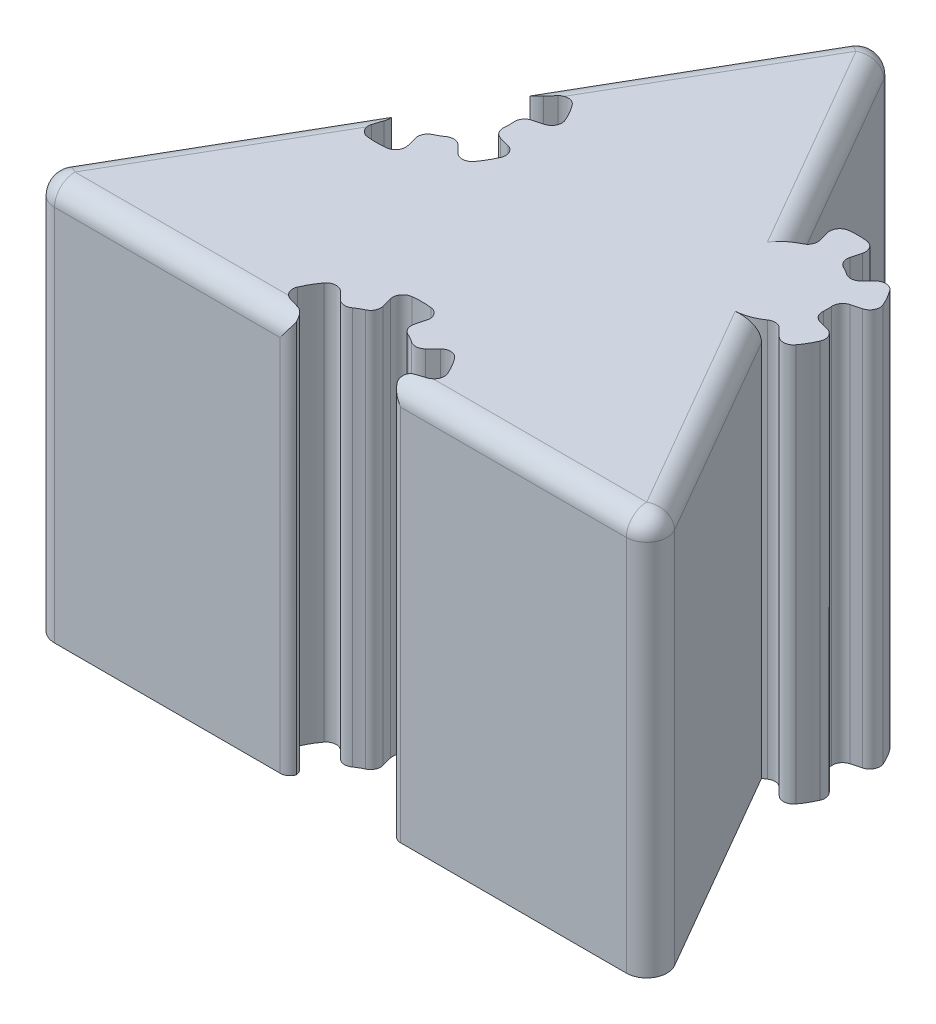
from build123d import *

# Parameters (mm, degrees)
BOSS_EXTRUDE1_DEPTH = 19.5
CUT_EXTRUDE1_DEPTH  = 30.603631534
BOSS_EXTRUDE2_DEPTH = 19.5
FILLET2_R           = 0.5
FILLET4_R           = 1
CUT_EXTRUDE6_DEPTH  = 17


with BuildPart() as part:
    # Sketch1 → Boss-Extrude1 (new body)
    with BuildSketch(Plane(origin=(0, 0, 0), x_dir=(1, 0, 0), z_dir=(0, 1, 0))):
        Polygon((0, 15.75), (-15.75, -11.529800219), (15.75, -11.529800219), align=None)
    extrude(amount=BOSS_EXTRUDE1_DEPTH)

    # Sketch2 → Cut-Extrude1 (cut, through all)
    with BuildSketch(Plane(origin=(0, 19.5, 0), x_dir=(1, 0, 0), z_dir=(0, 1, 0))):
        with BuildLine():
            Line((-6.625, 4.2751634), (-9.125, -0.054963619))
            ThreePointArc((-9.125, -0.054963619), (-8.831708581, -0.199598941), (-8.522047613, -0.304714675))
            Line((-8.522047613, -0.304714675), (-8.91027618, -1.753603415))
            ThreePointArc((-8.91027618, -1.753603415), (-7.875, -1.88990011), (-6.83972382, -1.753603415))
            Line((-6.83972382, -1.753603415), (-7.227952387, -0.304714675))
            ThreePointArc((-7.227952387, -0.304714675), (-6.625, -0.054963619), (-6.107233047, 0.342332937))
            Line((-6.107233047, 0.342332937), (-5.046572875, -0.718327234))
            ThreePointArc((-5.046572875, -0.718327234), (-4.410898385, 0.11009989), (-4.011296695, 1.07482371))
            Line((-4.011296695, 1.07482371), (-5.460185434, 1.463052278))
            ThreePointArc((-5.460185434, 1.463052278), (-5.375, 2.11009989), (-5.460185434, 2.757147503))
            Line((-5.460185434, 2.757147503), (-4.011296695, 3.145376071))
            ThreePointArc((-4.011296695, 3.145376071), (-4.410898385, 4.11009989), (-5.046572875, 4.938527015))
            Line((-5.046572875, 4.938527015), (-6.107233047, 3.877866843))
            ThreePointArc((-6.107233047, 3.877866843), (-6.353096427, 4.093483241), (-6.625, 4.2751634))
        make_face()
        with BuildLine():
            Line((-2.5, -11.529800219), (2.5, -11.529800219))
            ThreePointArc((2.5, -11.529800219), (2.478612153, -11.203484739), (2.414814566, -10.882752606))
            Line((2.414814566, -10.882752606), (3.863703305, -10.494524039))
            ThreePointArc((3.863703305, -10.494524039), (3.464101615, -9.529800219), (2.828427125, -8.701373094))
            Line((2.828427125, -8.701373094), (1.767766953, -9.762033266))
            ThreePointArc((1.767766953, -9.762033266), (1.25, -9.36473671), (0.647047613, -9.114985653))
            Line((0.647047613, -9.114985653), (1.03527618, -7.666096914))
            ThreePointArc((1.03527618, -7.666096914), (0, -7.529800219), (-1.03527618, -7.666096914))
            Line((-1.03527618, -7.666096914), (-0.647047613, -9.114985653))
            ThreePointArc((-0.647047613, -9.114985653), (-1.25, -9.36473671), (-1.767766953, -9.762033266))
            Line((-1.767766953, -9.762033266), (-2.828427125, -8.701373094))
            ThreePointArc((-2.828427125, -8.701373094), (-3.464101615, -9.529800219), (-3.863703305, -10.494524039))
            Line((-3.863703305, -10.494524039), (-2.414814566, -10.882752606))
            ThreePointArc((-2.414814566, -10.882752606), (-2.478612153, -11.203484739), (-2.5, -11.529800219))
        make_face()
    extrude(amount=-CUT_EXTRUDE1_DEPTH, mode=Mode.SUBTRACT)

    # Sketch2<3> → Boss-Extrude2 (add, through all)
    with BuildSketch(Plane(origin=(0, 19.5, 0), x_dir=(1, 0, 0), z_dir=(0, 1, 0))):
        with BuildLine():
            ThreePointArc((7.260304768, 4.404173728), (6.966126848, 4.30431378), (6.6875, 4.166910224))
            Line((6.6875, 4.166910224), (9.0625, 0.053289556))
            ThreePointArc((9.0625, 0.053289556), (9.320808394, 0.225885707), (9.554378605, 0.430721285))
            Line((9.554378605, 0.430721285), (10.615038777, -0.629938887))
            ThreePointArc((10.615038777, -0.629938887), (11.23084844, 0.17259989), (11.617962577, 1.107176091))
            Line((11.617962577, 1.107176091), (10.169073837, 1.495404658))
            ThreePointArc((10.169073837, 1.495404658), (10.25, 2.11009989), (10.169073837, 2.724795123))
            Line((10.169073837, 2.724795123), (11.617962577, 3.11302369))
            ThreePointArc((11.617962577, 3.11302369), (11.23084844, 4.04759989), (10.615038777, 4.850138667))
            Line((10.615038777, 4.850138667), (9.554378605, 3.789478496))
            ThreePointArc((9.554378605, 3.789478496), (9.0625, 4.166910224), (8.489695232, 4.404173728))
            Line((8.489695232, 4.404173728), (8.8779238, 5.853062467))
            ThreePointArc((8.8779238, 5.853062467), (7.875, 5.98509989), (6.8720762, 5.853062467))
            Line((6.8720762, 5.853062467), (7.260304768, 4.404173728))
        make_face()
    extrude(amount=-BOSS_EXTRUDE2_DEPTH)

    # Fillet2
    # the kernel refuses this fillet: 0.5 mm, written as the material it adds along each edge
    with BuildSketch(Plane(origin=(10.169073837, 19.5, -1.495404658), x_dir=(0.9659258262890719, 0, 0.25881904510250725), z_dir=(0, -1, 0)), Plane(origin=(9.554378605, 19.5, -3.789478496), x_dir=(0.7071067811865348, 0, -0.7071067811865601), z_dir=(0, -1, 0))) as fillet2_piece_1:
        with BuildLine():
            CenterArc((0.456187913, -0.5), FILLET2_R, 90, 79.984589832)
            ThreePointArc((-0.036192593, -0.413043478), (-0.00906545, -0.20731306), (0, 0))
            Line((0, 0), (0.456187913, 0))
        make_face()
    extrude(amount=19.5)
    with BuildSketch(Plane(origin=(9.554378605, 19.5, -0.430721285), x_dir=(-0.7661308776828692, 0, 0.6426845869171569), z_dir=(0, -1, 0)), Plane(origin=(8.489695232, 19.5, -4.404173728), x_dir=(0.9396466177324048, 0, 0.3421465092384431), z_dir=(0, -1, 0)), Plane(origin=(10.169073837, 19.5, -2.724795123), x_dir=(0.1735157400495422, 0, 0.9848310961556098), z_dir=(0, -1, 0))) as fillet2_piece_2:
        with BuildLine():
            CenterArc((0.458270974, -0.498091484), FILLET2_R, 95.007705084, 79.984589832)
            Line((-0.03982051, -0.45444663), (0, 0))
            ThreePointArc((0, 0), (0.20731306, -0.00906545), (0.414626119, 0))
        make_face()
    extrude(amount=19.5)
    with BuildSketch(Plane(origin=(7.260304768, 19.5, -4.404173728), x_dir=(-0.939646617732391, 0, 0.3421465092384808), z_dir=(0, -1, 0))) as fillet2_piece_3:
        with BuildLine():
            CenterArc((0.458270974, 0.498091484), FILLET2_R, 185.007705084, 79.984589832)
            Line((-0.03982051, 0.45444663), (0, 0))
            ThreePointArc((0, 0), (0.20731306, 0.00906545), (0.414626119, 0))
        make_face()
    extrude(amount=19.5)
    with BuildSketch(Plane(origin=(-5.046572875, 19.5, -4.938527015), x_dir=(0.6546536707079752, 0, 0.7559289460184561), z_dir=(0, -1, 0)), Plane(origin=(-4.011296695, 19.5, -1.07482371), x_dir=(-0.32732683535399293, 0, 0.9449111825230665), z_dir=(0, -1, 0)), Plane(origin=(-6.83972382, 19.5, 1.753603415), x_dir=(-0.9819805060619667, 0, 0.18898223650460844), z_dir=(0, -1, 0)), Plane(origin=(2.828427125, 19.5, 8.701373094), x_dir=(0.6546536707079803, 0, 0.7559289460184518), z_dir=(0, -1, 0)), Plane(origin=(-3.863703305, 19.5, 10.494524039), x_dir=(0.3273268353539898, 0, -0.9449111825230676), z_dir=(0, -1, 0)), Plane(origin=(-1.03527618, 19.5, 7.666096914), x_dir=(0.9819805060619656, 0, -0.18898223650461404), z_dir=(0, -1, 0))) as fillet2_piece_4:
        with BuildLine():
            CenterArc((0.537093255, 0.498716267), FILLET2_R, 175.893394649, 98.213210702)
            Line((0.038376988, 0.534522484), (0, 0))
            ThreePointArc((0, 0), (0.286449736, -0.010269865), (0.572899472, 0))
        make_face()
    extrude(amount=19.5)
    with BuildSketch(Plane(origin=(-4.011296695, 19.5, -3.145376071), x_dir=(-0.9659258262890685, 0, 0.25881904510251963), z_dir=(0, -1, 0)), Plane(origin=(-5.046572875, 19.5, 0.718327234), x_dir=(-0.7071067811865451, 0, -0.7071067811865498), z_dir=(0, -1, 0)), Plane(origin=(-8.91027618, 19.5, 1.753603415), x_dir=(0.25881904510252574, 0, -0.965925826289067), z_dir=(0, -1, 0)), Plane(origin=(3.863703305, 19.5, 10.494524039), x_dir=(-0.9659258262890678, 0, 0.2588190451025225), z_dir=(0, -1, 0)), Plane(origin=(-2.828427125, 19.5, 8.701373094), x_dir=(0.7071067811865509, 0, 0.7071067811865442), z_dir=(0, -1, 0)), Plane(origin=(1.03527618, 19.5, 7.666096914), x_dir=(-0.2588190451025172, 0, 0.9659258262890692), z_dir=(0, -1, 0))) as fillet2_piece_5:
        with BuildLine():
            CenterArc((0.535898385, 0.5), FILLET2_R, 171.786789298, 98.213210702)
            ThreePointArc((0.041026726, 0.571428571), (0.010269865, 0.286449736), (0, 0))
            Line((0, 0), (0.535898385, 0))
        make_face()
    extrude(amount=19.5)
    # the kernel refuses this fillet: 0.5 mm, written as the material it takes off along each edge
    with BuildSketch(Plane(origin=(11.617962577, 20.939160897, -1.107176091), x_dir=(-0.32985231937678383, 0, 0.944032545732273), z_dir=(0, -1, 0)), Plane(origin=(6.8720762, 20.939160897, -5.853062467), x_dir=(0.9824823262918342, 0, -0.1863557847886294), z_dir=(0, -1, 0)), Plane(origin=(10.615038777, 20.939160897, -4.850138667), x_dir=(0.6526300069150524, 0, 0.7576767609436486), z_dir=(0, -1, 0))) as fillet2_2_piece_1:
        with BuildLine():
            CenterArc((0.538524723, 0.49861874), FILLET2_R, 175.740187873, 98.519624254)
            Line((0.039905983, 0.535758376), (0, 0))
            ThreePointArc((0, 0), (0.287832179, -0.010704768), (0.575664359, 0))
        make_face()
    extrude(amount=22.378321794, mode=Mode.SUBTRACT)
    with BuildSketch(Plane(origin=(10.615038777, 20.939160897, 0.629938887), x_dir=(-0.7071067811865556, 0, -0.7071067811865395), z_dir=(0, -1, 0)), Plane(origin=(8.8779238, 20.939160897, -5.853062467), x_dir=(-0.2588190451025015, 0, 0.9659258262890735), z_dir=(0, -1, 0)), Plane(origin=(11.617962577, 20.939160897, -3.11302369), x_dir=(-0.9659258262890641, 0, 0.25881904510253667), z_dir=(0, -1, 0))) as fillet2_2_piece_2:
        with BuildLine():
            CenterArc((0.537242519, 0.5), FILLET2_R, 171.480375746, 98.519624254)
            ThreePointArc((0.04275993, 0.574074074), (0.010704768, 0.287832179), (0, 0))
            Line((0, 0), (0.537242519, 0))
        make_face()
    extrude(amount=22.378321794, mode=Mode.SUBTRACT)
    with BuildSketch(Plane(origin=(-6.107233047, 20.645099729, -3.877866843), x_dir=(-0.7637626158259737, 0, -0.6454972243679022), z_dir=(0, -1, 0)), Plane(origin=(-5.460185434, 20.645099729, -1.463052278), x_dir=(0.17713568646196357, 0, -0.9841864399500986), z_dir=(0, -1, 0)), Plane(origin=(-7.227952387, 20.645099729, 0.304714675), x_dir=(0.9408983022879361, 0, -0.33868921558219084), z_dir=(0, -1, 0)), Plane(origin=(-9.125, 20.645099729, 0.054963619), x_dir=(0.9048050110076324, 0, 0.4258261289017831), z_dir=(0, -1, 0)), Plane(origin=(1.767766953, 20.645099729, 9.762033266), x_dir=(-0.7637626158259726, 0, -0.6454972243679037), z_dir=(0, -1, 0)), Plane(origin=(2.5, 20.645099729, 11.529800219), x_dir=(-0.08362626027968346, 0, -0.9964971894549601), z_dir=(0, -1, 0)), Plane(origin=(-2.414814566, 20.645099729, 10.882752606), x_dir=(-0.17713568646195918, 0, 0.9841864399500994), z_dir=(0, -1, 0)), Plane(origin=(-0.647047613, 20.645099729, 9.114985653), x_dir=(-0.9408983022879326, 0, 0.3386892155822002), z_dir=(0, -1, 0))) as fillet2_2_piece_3:
        with BuildLine():
            CenterArc((0.459944432, 0.498248595), FILLET2_R, 184.797034113, 80.405931773)
            Line((-0.038304163, 0.456435465), (0, 0))
            ThreePointArc((0, 0), (0.209065651, 0.008757026), (0.418131301, 0))
        make_face()
    extrude(amount=21.790199458, mode=Mode.SUBTRACT)
    with BuildSketch(Plane(origin=(-5.460185434, 20.645099729, -2.757147503), x_dir=(0.9659258262890686, 0, -0.2588190451025195), z_dir=(0, -1, 0)), Plane(origin=(-6.107233047, 20.645099729, -0.342332937), x_dir=(0.7071067811865452, 0, 0.7071067811865499), z_dir=(0, -1, 0)), Plane(origin=(-8.522047613, 20.645099729, 0.304714675), x_dir=(-0.25881904510252535, 0, 0.9659258262890671), z_dir=(0, -1, 0)), Plane(origin=(-6.625, 20.645099729, -4.2751634), x_dir=(0.49999999999999917, 0, -0.8660254037844392), z_dir=(0, -1, 0)), Plane(origin=(2.414814566, 20.645099729, 10.882752606), x_dir=(0.965925826289068, 0, -0.2588190451025218), z_dir=(0, -1, 0)), Plane(origin=(-2.5, 20.645099729, 11.529800219), x_dir=(-1, 0, 0), z_dir=(0, -1, 0)), Plane(origin=(-1.767766953, 20.645099729, 9.762033266), x_dir=(-0.7071067811865519, 0, -0.7071067811865431), z_dir=(0, -1, 0)), Plane(origin=(0.647047613, 20.645099729, 9.114985653), x_dir=(0.2588190451025169, 0, -0.9659258262890693), z_dir=(0, -1, 0))) as fillet2_2_piece_4:
        with BuildLine():
            CenterArc((0.458039892, 0.5), FILLET2_R, 189.594068227, 80.405931773)
            ThreePointArc((-0.034966757, 0.416666667), (-0.008757026, 0.209065651), (0, 0))
            Line((0, 0), (0.458039892, 0))
        make_face()
    extrude(amount=21.790199458, mode=Mode.SUBTRACT)

    # Fillet4
    # the kernel refuses this fillet: 1 mm, written as the material it takes off along each edge
    with BuildSketch(Plane(origin=(-14.017949192, 18.5, 10.529800219), x_dir=(0, 0, 1), z_dir=(0, 1, 0))) as fillet4_piece_1_section:
        Polygon((0, 0), (FILLET4_R, 0), (FILLET4_R, -FILLET4_R * 1.73205080757), (-FILLET4_R * 0.5, -FILLET4_R * 0.866025403784), align=None)
    fillet4_piece_1 = extrude(amount=FILLET4_R, mode=Mode.PRIVATE)
    fillet4_piece_1 = fillet4_piece_1 - Plane(origin=(-14.017949192, 18.5, 10.529800219), x_dir=(0.8660254037844387, 0, -0.5), z_dir=(0, 1, 0)) * Sphere(FILLET4_R, mode=Mode.PRIVATE)
    add(fillet4_piece_1, mode=Mode.SUBTRACT)
    with BuildSketch(Plane(origin=(14.017949192, 18.5, 10.529800219), x_dir=(0.8660254037844387, 0, -0.5), z_dir=(0, 1, 0))) as fillet4_piece_2_section:
        Polygon((0, 0), (FILLET4_R, 0), (FILLET4_R, -FILLET4_R * 1.73205080757), (-FILLET4_R * 0.5, -FILLET4_R * 0.866025403784), align=None)
    fillet4_piece_2 = extrude(amount=FILLET4_R, mode=Mode.PRIVATE)
    fillet4_piece_2 = fillet4_piece_2 - Plane(origin=(14.017949192, 18.5, 10.529800219), x_dir=(-0.8660254037844387, 0, -0.5), z_dir=(0, 1, 0)) * Sphere(FILLET4_R, mode=Mode.PRIVATE)
    add(fillet4_piece_2, mode=Mode.SUBTRACT)
    with BuildSketch(Plane(origin=(0, 18.5, -13.75), x_dir=(-0.8660254037844387, 0, -0.5), z_dir=(0, 1, 0))) as fillet4_piece_3_section:
        Polygon((0, 0), (FILLET4_R, 0), (FILLET4_R, -FILLET4_R * 1.73205080757), (-FILLET4_R * 0.5, -FILLET4_R * 0.866025403784), align=None)
    fillet4_piece_3 = extrude(amount=FILLET4_R, mode=Mode.PRIVATE)
    fillet4_piece_3 = fillet4_piece_3 - Plane(origin=(0, 18.5, -13.75), x_dir=(0, 0, 1), z_dir=(0, 1, 0)) * Sphere(FILLET4_R, mode=Mode.PRIVATE)
    add(fillet4_piece_3, mode=Mode.SUBTRACT)
    with BuildSketch(Plane(origin=(-15.75, -4.330127019, 11.529800219), x_dir=(1, 0, 0), z_dir=(0, 1, 0)), Plane(origin=(15.75, -4.330127019, 11.529800219), x_dir=(-0.49999999999999994, 0, -0.8660254037844387), z_dir=(0, 1, 0)), Plane(origin=(0, -4.330127019, -15.75), x_dir=(-0.5000000000000001, 0, 0.8660254037844387), z_dir=(0, 1, 0))) as fillet4_piece_4:
        with BuildLine():
            CenterArc((FILLET4_R * 1.73205080757, FILLET4_R), FILLET4_R, 150, 120)
            Line((FILLET4_R * 0.866025403784, FILLET4_R * 1.5), (0, 0))
            Line((0, 0), (FILLET4_R * 1.73205080757, 0))
        make_face()
    extrude(amount=22.830127019, mode=Mode.SUBTRACT)
    with BuildSketch(Plane(origin=(14.883974596, 19.5, 10.029800219), x_dir=(-0.8660254037844386, 0, 0.49999999999999994), z_dir=(-0.5, 0, -0.8660254037844387))) as fillet4_piece_5_section:
        with BuildLine():
            CenterArc((FILLET4_R, -FILLET4_R), FILLET4_R, 90, 90)
            Line((0, -FILLET4_R), (0, 0))
            Line((0, 0), (FILLET4_R, 0))
        make_face()
    fillet4_piece_5 = extrude(amount=14.142949192, mode=Mode.PRIVATE)
    fillet4_piece_5 = fillet4_piece_5 - Plane(origin=(7.875, 19.273902708, -2.11009989), x_dir=(0.5000000000000021, 0, 0.8660254037844375), z_dir=(0, 1, 0)) * Cylinder(2.375, 33, mode=Mode.PRIVATE)
    add(fillet4_piece_5, mode=Mode.SUBTRACT)
    with BuildSketch(Plane(origin=(7.9375, 19.5, -2.001846715), x_dir=(-0.8660254037844387, 0, 0.49999999999999994), z_dir=(-0.5, 0, -0.8660254037844387))) as fillet4_piece_6_section:
        with BuildLine():
            CenterArc((FILLET4_R, -FILLET4_R), FILLET4_R, 90, 90)
            Line((0, -FILLET4_R), (0, 0))
            Line((0, 0), (FILLET4_R, 0))
        make_face()
    fillet4_piece_6 = extrude(amount=14.142949192, mode=Mode.PRIVATE)
    fillet4_piece_6 = fillet4_piece_6 - Plane(origin=(7.875, 19.273902719, -2.11009989), x_dir=(-0.2588190451025377, 0, -0.9659258262890638), z_dir=(0, 1, 0)) * Cylinder(2.375, 33, mode=Mode.PRIVATE)
    add(fillet4_piece_6, mode=Mode.SUBTRACT)
    with BuildSketch(Plane(origin=(-0.866025404, 19.5, -14.25), x_dir=(0.8660254037844387, 0, 0.5), z_dir=(-0.5, 0, 0.8660254037844387)), Plane(origin=(-8.104019946, 19.5, -1.713425708), x_dir=(0.8660254037844387, 0, 0.49999999999999994), z_dir=(-0.5, 0, 0.8660254037844387)), Plane(origin=(-14.017949192, 19.5, 11.529800219), x_dir=(0, 0, -1), z_dir=(1, 0, 0)), Plane(origin=(0.458039892, 19.5, 11.529800219), x_dir=(0, 0, -1), z_dir=(1, 0, 0))) as fillet4_piece_7:
        with BuildLine():
            CenterArc((FILLET4_R, -FILLET4_R), FILLET4_R, 90, 90)
            Line((0, -FILLET4_R), (0, 0))
            Line((0, 0), (FILLET4_R, 0))
        make_face()
    extrude(amount=13.559909301, mode=Mode.SUBTRACT)

    # Sketch9 → Cut-Extrude6 (cut)
    with BuildSketch(Plane.XZ):
        with BuildLine():
            Line((-0.512435565, -13.837564435), (-4.582560115, -5.602926769))
            ThreePointArc((-4.582560115, -5.602926769), (-3.143714224, -2.919380374), (-3.608820434, 0.089834634))
            Line((-3.608820434, 0.089834634), (-2.040464918, 2.806306072))
            Line((-2.040464918, 2.806306072), (6.312564435, -2.016317673))
            Line((6.312564435, -2.016317673), (-0.512435565, -13.837564435))
        make_face()
        with BuildLine():
            Line((-1.232174541, 4.206306072), (0.227890598, 6.735213076))
            ThreePointArc((0.227890598, 6.735213076), (2.947362483, 7.741257704), (4.591296113, 10.129800219))
            Line((4.591296113, 10.129800219), (13.325128869, 10.129800219))
            Line((13.325128869, 10.129800219), (7.120854812, -0.616317673))
            Line((7.120854812, -0.616317673), (-1.232174541, 4.206306072))
        make_face()
        with BuildLine():
            Line((-8.709523932, 2.61679865), (-13.851701015, 10.344687463))
            Line((-13.851701015, 10.344687463), (-4.587768064, 10.118281819))
            ThreePointArc((-4.587768064, 10.118281819), (-3.361342063, 8.103230574), (-1.323094728, 6.915754236))
            Line((-1.323094728, 6.915754236), (-4.540666328, 1.342756748))
            ThreePointArc((-4.540666328, 1.342756748), (-6.472125139, 2.480318623), (-8.709523932, 2.61679865))
        make_face()
    extrude(amount=-CUT_EXTRUDE6_DEPTH, mode=Mode.SUBTRACT)


solid = part.part
